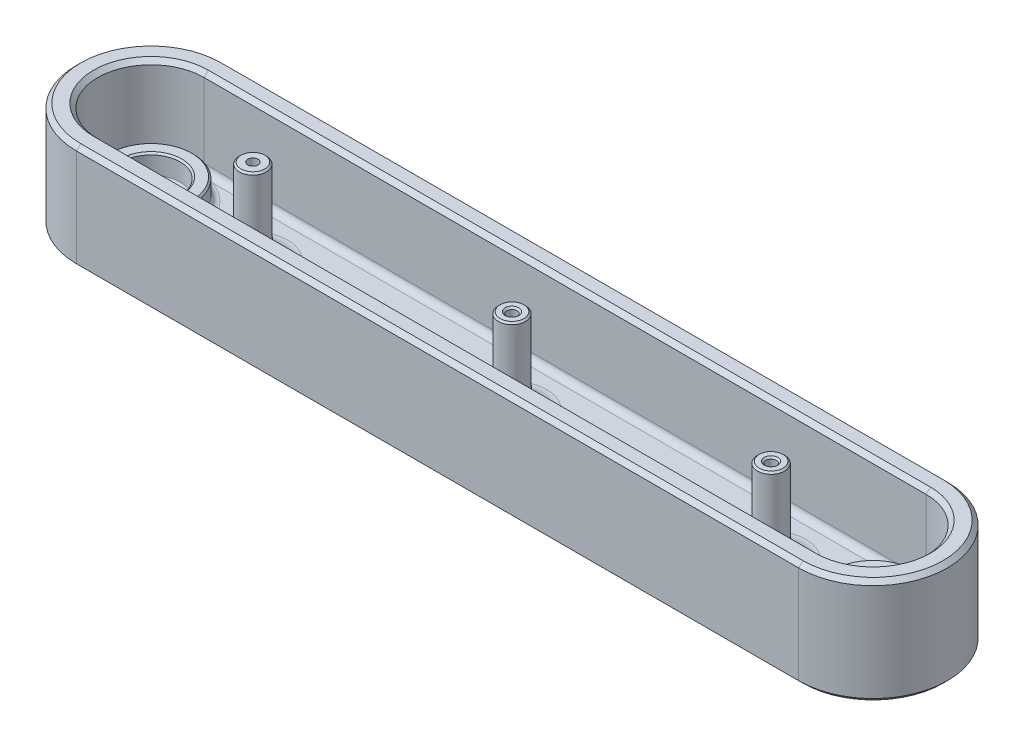
from build123d import *

# Parameters (mm, degrees)
MAINBLOCK_DEPTH     = 31.75
MAINPOCKET_DEPTH    = 25.4
SKETCH3_R           = 3.81
CUT_EXTRUDE1_DEPTH  = 136.82173519
SKETCH4_R           = 12.7
SKETCH4_R_2         = 8.73125
BOSS_EXTRUDE1_DEPTH = 6.35
SKETCH7_R           = 4.064
SKETCH7_R_2         = 1.524
BOSS_EXTRUDE3_DEPTH = 25.4
FILLET2_R           = 0.635
FILLET3_R           = 1.905
FILLET6_R           = 6.35
BOSS_EXTRUDE4_START = 6.35
SKETCH9_R           = 6.35
SKETCH9_R_2         = 3.81
BOSS_EXTRUDE4_DEPTH = 6.35
FILLET7_R           = 1.27
CHAMFER2_SIZE       = 0.508
CHAMFER3_SIZE       = 1.27
CHAMFER4_SIZE       = 1.27


with BuildPart() as part:
    # Sketch1 → MainBlock (new body)
    with BuildSketch(Plane(origin=(0, 0, 0), x_dir=(1, 0, 0), z_dir=(0, 1, 0))):
        with BuildLine():
            Line((-107.95, 22.225), (107.95, 22.225))
            ThreePointArc((107.95, 22.225), (130.175, 0), (107.95, -22.225))
            Line((107.95, -22.225), (-107.95, -22.225))
            ThreePointArc((-107.95, -22.225), (-130.175, 0), (-107.95, 22.225))
        make_face()
    extrude(amount=MAINBLOCK_DEPTH)

    # Sketch2 → MainPocket (cut)
    with BuildSketch(Plane(origin=(0, 31.75, 0), x_dir=(1, 0, 0), z_dir=(0, 1, 0))):
        with BuildLine():
            Line((-107.95, 15.875), (107.95, 15.875))
            ThreePointArc((107.95, 15.875), (123.825, 0), (107.95, -15.875))
            Line((107.95, -15.875), (-107.95, -15.875))
            ThreePointArc((-107.95, -15.875), (-123.825, 0), (-107.95, 15.875))
        make_face()
    extrude(amount=-MAINPOCKET_DEPTH, mode=Mode.SUBTRACT)

    # Sketch3 → Cut-Extrude1 (cut, through all)
    with BuildSketch(Plane.XZ):
        with Locations(Location((-107.95, 0, 0), (0, 0, 270))):
            Circle(SKETCH3_R)
        with Locations(Location((107.95, 0, 0), (0, 0, 270))):
            Circle(SKETCH3_R)
    extrude(amount=-CUT_EXTRUDE1_DEPTH, mode=Mode.SUBTRACT)

    # Sketch4 → Boss-Extrude1 (add)
    # profile 1 of 2: a face of its own
    with BuildSketch(Plane(origin=(0, 6.35, 0), x_dir=(1, 0, 0), z_dir=(0, 1, 0))):
        with Locations(Location((-107.95, 0, 0), (0, 0, 90))):
            Circle(SKETCH4_R)
        with Locations(Location((-107.95, 0, 0), (0, 0, 270))):
            Circle(SKETCH4_R_2, mode=Mode.SUBTRACT)
    # profile 2 of 2: a face of its own
    with BuildSketch(Plane(origin=(0, 6.35, 0), x_dir=(1, 0, 0), z_dir=(0, 1, 0))):
        with Locations(Location((107.95, 0, 0), (0, 0, 90))):
            Circle(SKETCH4_R)
        with Locations(Location((107.95, 0, 0), (0, 0, 90))):
            Circle(SKETCH4_R_2, mode=Mode.SUBTRACT)
    extrude(amount=BOSS_EXTRUDE1_DEPTH)

    # Sketch7 → Boss-Extrude3 (add)
    # profile 1 of 3: a face of its own
    with BuildSketch(Plane(origin=(0, 6.35, 0), x_dir=(1, 0, 0), z_dir=(0, 1, 0))):
        with Locations(Location((-77.47, 0, 0), (0, 0, 90))):
            Circle(SKETCH7_R)
        with Locations(Location((-77.47, 0, 0), (0, 0, 270))):
            Circle(SKETCH7_R_2, mode=Mode.SUBTRACT)
    # profile 2 of 3: a face of its own
    with BuildSketch(Plane(origin=(0, 6.35, 0), x_dir=(1, 0, 0), z_dir=(0, 1, 0))):
        with Locations(Location((0, 0, 0), (0, 0, 90))):
            Circle(SKETCH7_R)
        with Locations(Location((0, 0, 0), (0, 0, 270))):
            Circle(SKETCH7_R_2, mode=Mode.SUBTRACT)
    # profile 3 of 3: a face of its own
    with BuildSketch(Plane(origin=(0, 6.35, 0), x_dir=(1, 0, 0), z_dir=(0, 1, 0))):
        with Locations(Location((77.47, 0, 0), (0, 0, 90))):
            Circle(SKETCH7_R)
        with Locations(Location((77.47, 0, 0), (0, 0, 270))):
            Circle(SKETCH7_R_2, mode=Mode.SUBTRACT)
    extrude(amount=BOSS_EXTRUDE3_DEPTH)

    # Fillet2
    fillet2_edges = [part.edges().sort_by_distance(p)[0] for p in [
        (-107.95, 6.35, -8.73125),
        (107.95, 6.35, 8.73125),
    ]]
    fillet(fillet2_edges, radius=FILLET2_R)

    # Fillet3
    # the kernel refuses this fillet: 1.905 mm, written as the material it adds along each edge
    with BuildSketch(Plane(origin=(107.95, 6.35, 0), x_dir=(0, 0, -1), z_dir=(-1, 0, 0))) as fillet3_piece_1:
        with BuildLine():
            CenterArc((15.875 - FILLET3_R, -FILLET3_R), FILLET3_R, 360, 90)
            Line((15.875, -FILLET3_R), (15.875, 0))
            Line((15.875, 0), (15.875 - FILLET3_R, 0))
        make_face()
    revolve(axis=Axis((107.95, 6.35, 0), (0, -1, 0)), revolution_arc=180)
    with BuildSketch(Plane(origin=(107.95, 6.35, 15.875), x_dir=(0, 0, -1), z_dir=(-1, 0, 0)), Plane(origin=(-107.95, 6.35, -15.875), x_dir=(0, 0, 1), z_dir=(1, 0, 0))) as fillet3_piece_2:
        with BuildLine():
            CenterArc((FILLET3_R, -FILLET3_R), FILLET3_R, 90, 90)
            Line((0, -FILLET3_R), (0, 0))
            Line((0, 0), (FILLET3_R, 0))
        make_face()
    extrude(amount=215.9)
    with BuildSketch(Plane(origin=(-107.95, 6.35, 0), x_dir=(0, 0, 1), z_dir=(1, 0, 0))) as fillet3_piece_3:
        with BuildLine():
            CenterArc((15.875 - FILLET3_R, -FILLET3_R), FILLET3_R, 360, 90)
            Line((15.875, -FILLET3_R), (15.875, 0))
            Line((15.875, 0), (15.875 - FILLET3_R, 0))
        make_face()
    revolve(axis=Axis((-107.95, 6.35, 0), (0, -1, 0)), revolution_arc=180)
    with BuildSketch(Plane(origin=(-107.95, 6.35, 0), x_dir=(0, 0, -1), z_dir=(1, 0, 0))) as fillet3_piece_4:
        with BuildLine():
            CenterArc((12.7 + FILLET3_R, FILLET3_R), FILLET3_R, 180, 90)
            Line((12.7, FILLET3_R), (12.7, 0))
            Line((12.7, 0), (12.7 + FILLET3_R, 0))
        make_face()
    revolve(axis=Axis((-107.95, 6.35, 0), (0, 1, 0)))
    with BuildSketch(Plane(origin=(107.95, 6.35, 0), x_dir=(0, 0, -1), z_dir=(1, 0, 0))) as fillet3_piece_5:
        with BuildLine():
            CenterArc((12.7 + FILLET3_R, FILLET3_R), FILLET3_R, 180, 90)
            Line((12.7 + FILLET3_R, 0), (12.7, 0))
            Line((12.7, 0), (12.7, FILLET3_R))
        make_face()
    revolve(axis=Axis((107.95, 6.35, 0), (0, 1, 0)))

    # Fillet6
    fillet6_edges = [part.edges().sort_by_distance(p)[0] for p in [
        (-77.47, 6.35, 4.064),
        (0, 6.35, 4.064),
        (77.47, 6.35, 4.064),
    ]]
    fillet(fillet6_edges, radius=FILLET6_R)

    # Sketch9 → Boss-Extrude4 (add)
    with BuildSketch(Plane.XZ.offset(BOSS_EXTRUDE4_START)):
        with Locations(Location((107.95, 0, 0), (0, 0, 90))):
            Circle(SKETCH9_R)
        with Locations(Location((107.95, 0, 0), (0, 0, 270))):
            Circle(SKETCH9_R_2, mode=Mode.SUBTRACT)
    extrude(amount=-BOSS_EXTRUDE4_DEPTH)

    # Fillet7
    fillet7_edges = [part.edges().sort_by_distance(p)[0] for p in [
        (107.95, 0, -6.35),
    ]]
    fillet(fillet7_edges, radius=FILLET7_R)

    # Chamfer2
    chamfer2_edges = [part.edges().sort_by_distance(p)[0] for p in [
        (-107.95, 6.35, 3.81),
        (107.95, 6.35, 3.81),
        (-107.95, 12.7, 12.7),
        (-107.95, 12.7, -8.73125),
        (107.95, 12.7, 12.7),
        (107.95, 12.7, 8.73125),
        (-77.47, 31.75, 4.064),
        (0, 31.75, -1.524),
        (0, 31.75, 4.064),
        (77.47, 31.75, -1.524),
        (77.47, 31.75, 4.064),
    ]]
    chamfer(chamfer2_edges, length=CHAMFER2_SIZE)

    # Chamfer3
    chamfer3_edges = [part.edges().sort_by_distance(p)[0] for p in [
        (130.175, 31.75, 0),
        (0, 31.75, -22.225),
        (123.825, 31.75, 0),
        (0, 31.75, -15.875),
        (-123.825, 31.75, 0),
        (0, 31.75, 15.875),
        (-130.175, 31.75, 0),
        (0, 31.75, 22.225),
    ]]
    chamfer(chamfer3_edges, length=CHAMFER3_SIZE)

    # Chamfer4
    chamfer4_edges = [part.edges().sort_by_distance(p)[0] for p in [
        (0, 0, -22.225),
        (130.175, 0, 0),
        (0, 0, 22.225),
        (-130.175, 0, 0),
    ]]
    chamfer(chamfer4_edges, length=CHAMFER4_SIZE)


solid = part.part
